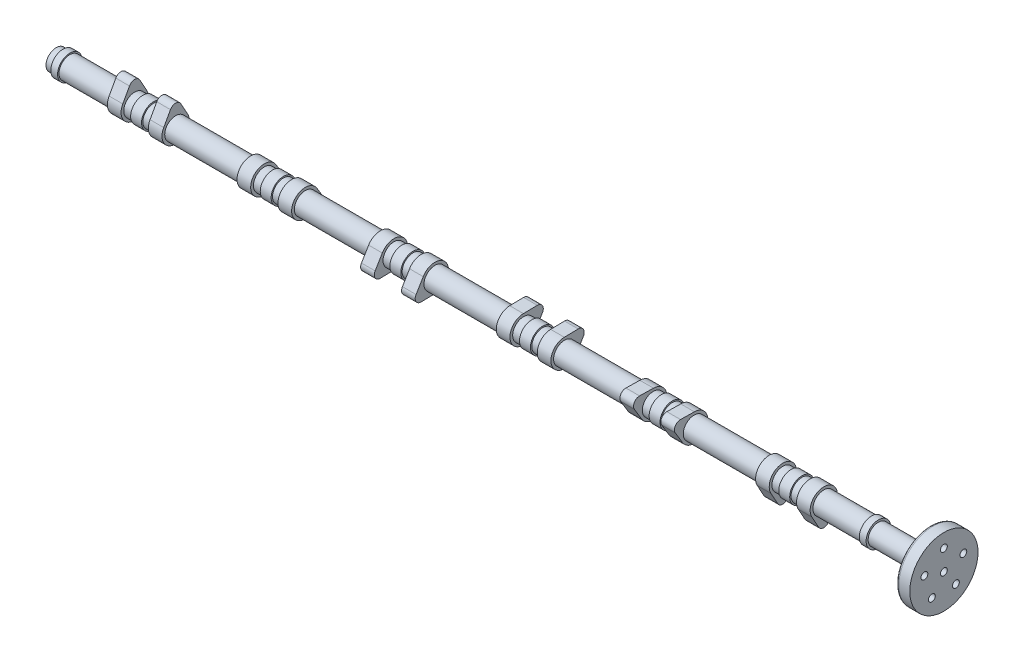
from build123d import *

# Parameters (mm, degrees)
SKETCH1_R             = 8
BOSS_EXTRUDE1_DEPTH   = 47.5
BOSS_EXTRUDE2_START   = 10
BOSS_EXTRUDE2_DEPTH   = 10
SKETCH3_R             = 9
BOSS_EXTRUDE3_DEPTH   = 4
LPATTERN1_COUNT       = 6
LPATTERN1_PITCH       = 95
BODY_MOVE_COPY1_ANGLE = 60
BODY_MOVE_COPY2_ANGLE = 120
BODY_MOVE_COPY3_ANGLE = 60
BODY_MOVE_COPY4_ANGLE = 120
BODY_MOVE_COPY5_ANGLE = 180
SKETCH4_R             = 8
BOSS_EXTRUDE4_DEPTH   = 10
SKETCH5_R             = 9
BOSS_EXTRUDE5_DEPTH   = 5
SKETCH6_R             = 7.5
BOSS_EXTRUDE6_DEPTH   = 5
SKETCH7_R             = 8
BOSS_EXTRUDE7_DEPTH   = 7.5
SKETCH8_R             = 9
BOSS_EXTRUDE8_DEPTH   = 5
SKETCH9_R             = 7.5
BOSS_EXTRUDE9_DEPTH   = 38
SKETCH10_R            = 25
SKETCH10_R_2          = 2.5
BOSS_EXTRUDE10_DEPTH  = 10
SKETCH11_R            = 2.5
CUT_EXTRUDE1_DEPTH    = 15
FILLET1_R             = 2


with BuildPart() as part:
    # Sketch1 → Boss-Extrude1 (new, symmetric)
    with BuildSketch(Plane(origin=(0, 0, 0), x_dir=(0, 0, -1), z_dir=(1, 0, 0))):
        Circle(SKETCH1_R)
    extrude(amount=BOSS_EXTRUDE1_DEPTH, both=True)

    # Sketch2 → Boss-Extrude2 (add)
    with BuildSketch(Plane(origin=(0, 0, 0), x_dir=(0, 0, -1), z_dir=(1, 0, 0)).offset(BOSS_EXTRUDE2_START)):
        with BuildLine():
            Line((-8.746197071, -4.848096202), (-3.807936598, -13.756953924))
            ThreePointArc((-3.807936598, -13.756953924), (0, -16), (3.807936598, -13.756953924))
            Line((3.807936598, -13.756953924), (8.746197071, -4.848096202))
            ThreePointArc((8.746197071, -4.848096202), (0, 10), (-8.746197071, -4.848096202))
        make_face()
    boss_extrude2 = extrude(amount=BOSS_EXTRUDE2_DEPTH)

    # Mirror1: Boss-Extrude2 across plane
    add(boss_extrude2.mirror(Plane(origin=(0, 0, 0), x_dir=(0, 0, 1), z_dir=(1, 0, 0))))

    # Sketch3 → Boss-Extrude3 (add, symmetric)
    with BuildSketch(Plane(origin=(0, 0, 0), x_dir=(0, 0, -1), z_dir=(1, 0, 0))):
        Circle(SKETCH3_R)
    extrude(amount=BOSS_EXTRUDE3_DEPTH, both=True)


with BuildPart() as lpattern1_1:
    # LPattern1: pattern copy
    add(part.part.moved(Location(Vector(-1, 0, 0) * (1 * LPATTERN1_PITCH))))


with BuildPart() as lpattern1_2:
    # LPattern1: pattern copy
    add(part.part.moved(Location(Vector(-1, 0, 0) * (2 * LPATTERN1_PITCH))))


with BuildPart() as lpattern1_3:
    # LPattern1: pattern copy
    add(part.part.moved(Location(Vector(-1, 0, 0) * (3 * LPATTERN1_PITCH))))


with BuildPart() as lpattern1_4:
    # LPattern1: pattern copy
    add(part.part.moved(Location(Vector(-1, 0, 0) * (4 * LPATTERN1_PITCH))))


with BuildPart() as lpattern1_5:
    # LPattern1: pattern copy
    add(part.part.moved(Location(Vector(-1, 0, 0) * (5 * LPATTERN1_PITCH))))


with BuildPart() as lpattern1_3_1:
    # Body-Move/Copy1: moved
    add(lpattern1_3.part.rotate(Axis((0, 0, 0), (-1, 0, 0)), BODY_MOVE_COPY1_ANGLE))


with BuildPart() as lpattern1_1_1:
    # Body-Move/Copy2: moved
    add(lpattern1_1.part.rotate(Axis((0, 0, 0), (-1, 0, 0)), BODY_MOVE_COPY2_ANGLE))


with BuildPart() as lpattern1_4_1:
    # Body-Move/Copy3: moved
    add(lpattern1_4.part.rotate(Axis((0, 0, 0), (1, 0, 0)), BODY_MOVE_COPY3_ANGLE))


with BuildPart() as lpattern1_2_1:
    # Body-Move/Copy4: moved
    add(lpattern1_2.part.rotate(Axis((0, 0, 0), (1, 0, 0)), BODY_MOVE_COPY4_ANGLE))


with BuildPart() as lpattern1_5_1:
    # Body-Move/Copy5: moved
    add(lpattern1_5.part.rotate(Axis((0, 0, 0), (1, 0, 0)), BODY_MOVE_COPY5_ANGLE))

    # Sketch4 → Boss-Extrude4 (add)
    with BuildSketch(Plane.ZY.offset(522.5)):
        Circle(SKETCH4_R)
    extrude(amount=BOSS_EXTRUDE4_DEPTH)

    # Sketch5 → Boss-Extrude5 (add)
    with BuildSketch(Plane.ZY.offset(532.5)):
        Circle(SKETCH5_R)
    extrude(amount=BOSS_EXTRUDE5_DEPTH)


with BuildPart() as lpattern1_4_2:
    add(lpattern1_4_1.part)

    # Combine1: union LPattern1_1, LPattern1_3, LPattern1_2, part, LPattern1_5
    add(lpattern1_1_1.part)
    add(lpattern1_3_1.part)
    add(lpattern1_2_1.part)
    add(part.part)
    add(lpattern1_5_1.part)

    # Sketch6 → Boss-Extrude6 (add)
    with BuildSketch(Plane.ZY.offset(537.5)):
        Circle(SKETCH6_R)
    extrude(amount=BOSS_EXTRUDE6_DEPTH)

    # Sketch7 → Boss-Extrude7 (add)
    with BuildSketch(Plane(origin=(47.5, 0, 0), x_dir=(0, 0, -1), z_dir=(1, 0, 0))):
        Circle(SKETCH7_R)
    extrude(amount=BOSS_EXTRUDE7_DEPTH)

    # Sketch8 → Boss-Extrude8 (add)
    with BuildSketch(Plane(origin=(55, 0, 0), x_dir=(0, 0, -1), z_dir=(1, 0, 0))):
        Circle(SKETCH8_R)
    extrude(amount=BOSS_EXTRUDE8_DEPTH)

    # Sketch9 → Boss-Extrude9 (add)
    with BuildSketch(Plane(origin=(60, 0, 0), x_dir=(0, 0, -1), z_dir=(1, 0, 0))):
        Circle(SKETCH9_R)
    extrude(amount=BOSS_EXTRUDE9_DEPTH)

    # Sketch10 → Boss-Extrude10 (add)
    with BuildSketch(Plane(origin=(98, 0, 0), x_dir=(0, 0, -1), z_dir=(1, 0, 0))):
        Circle(SKETCH10_R)
        Circle(SKETCH10_R_2, mode=Mode.SUBTRACT)
    extrude(amount=BOSS_EXTRUDE10_DEPTH)

    # Sketch11 → Cut-Extrude1 (cut)
    with BuildSketch(Plane(origin=(108, 0, 0), x_dir=(0, 0, -1), z_dir=(1, 0, 0))):
        with Locations((0, 15)):
            Circle(SKETCH11_R)
        Circle(SKETCH11_R)
        with Locations((14.265847744, 4.635254916)):
            Circle(SKETCH11_R)
        with Locations((8.816778784, -12.135254916)):
            Circle(SKETCH11_R)
        with Locations((-8.816778784, -12.135254916)):
            Circle(SKETCH11_R)
        with Locations((-14.265847744, 4.635254916)):
            Circle(SKETCH11_R)
    extrude(amount=-CUT_EXTRUDE1_DEPTH, mode=Mode.SUBTRACT)

    # Fillet1
    fillet1_edges = [lpattern1_4_2.edges().sort_by_distance(p)[0] for p in [
        (98, 0, 25),
        (98, 0, 7.5),
    ]]
    fillet(fillet1_edges, radius=FILLET1_R)


solid = lpattern1_4_2.part
